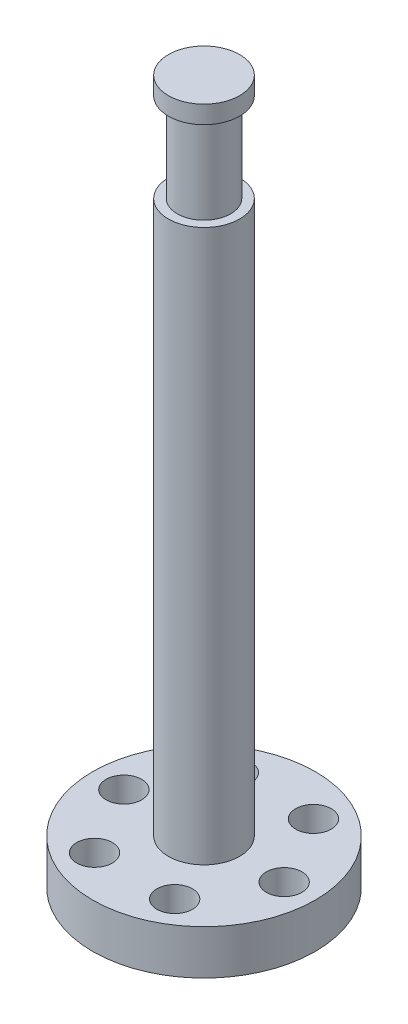
from build123d import *

# Parameters (mm, degrees)
SKETCH_1_R               = 12.5
EXTRUDE_1_DEPTH          = 79
SKETCH_2_OUTSIDE_W       = 44.31
SKETCH_2_OUTSIDE_H       = 44.31
SKETCH_2_OUTSIDE_R       = 4
CUT_EXTRUDE_2_DEPTH      = 72
SKETCH_4_OUTSIDE_W       = 44.31
SKETCH_4_OUTSIDE_H       = 44.31
SKETCH_4_OUTSIDE_R       = 4
CUT_EXTRUDE_3_DEPTH      = 80.003164494
SKETCH_6_OUTSIDE_W       = 44.31
SKETCH_6_OUTSIDE_H       = 44.31
SKETCH_6_OUTSIDE_R       = 3
CUT_EXTRUDE_4_DEPTH      = 10
SKETCH_7_R               = 2
CUT_EXTRUDE_5_DEPTH      = 81.953690466
PATTERN_CIRCULAR_1_COUNT = 6


with BuildPart() as part:
    # 草图1 → 凸台-拉伸1 (new body)
    with BuildSketch(Plane(origin=(0, 0, 0), x_dir=(1, 0, 0), z_dir=(0, 1, 0))):
        Circle(SKETCH_1_R)
    extrude(amount=EXTRUDE_1_DEPTH)

    # 草图2 outside → 切除-拉伸2 (cut)
    with BuildSketch(Plane(origin=(0, 77, 0), x_dir=(1, 0, 0), z_dir=(0, 1, 0))):
        Rectangle(SKETCH_2_OUTSIDE_W, SKETCH_2_OUTSIDE_H)
        Circle(SKETCH_2_OUTSIDE_R, mode=Mode.SUBTRACT)
    extrude(amount=-CUT_EXTRUDE_2_DEPTH, mode=Mode.SUBTRACT)

    # 草图4 outside → 切除-拉伸3 (cut, through all)
    with BuildSketch(Plane(origin=(0, 77, 0), x_dir=(1, 0, 0), z_dir=(0, 1, 0))):
        Rectangle(SKETCH_4_OUTSIDE_W, SKETCH_4_OUTSIDE_H)
        Circle(SKETCH_4_OUTSIDE_R, mode=Mode.SUBTRACT)
    extrude(amount=CUT_EXTRUDE_3_DEPTH, mode=Mode.SUBTRACT)

    # 草图6 outside → 切除-拉伸4 (cut)
    with BuildSketch(Plane(origin=(0, 77, 0), x_dir=(1, 0, 0), z_dir=(0, 1, 0))):
        Rectangle(SKETCH_6_OUTSIDE_W, SKETCH_6_OUTSIDE_H)
        Circle(SKETCH_6_OUTSIDE_R, mode=Mode.SUBTRACT)
    extrude(amount=-CUT_EXTRUDE_4_DEPTH, mode=Mode.SUBTRACT)

    # 草图7 → 切除-拉伸5 (cut, through all)
    with BuildSketch(Plane.XZ):
        with Locations((9, 0)):
            Circle(SKETCH_7_R)
    cut_extrude_5 = extrude(amount=-CUT_EXTRUDE_5_DEPTH, mode=Mode.SUBTRACT)

    # 阵列(圆周)1: 切除-拉伸5 ×6 about axis
    pattern_circular_1_axis = Axis((0, 0, 0), (0, 1, 0))
    for i in range(1, PATTERN_CIRCULAR_1_COUNT):
        add(cut_extrude_5.rotate(pattern_circular_1_axis, i * 360 / PATTERN_CIRCULAR_1_COUNT), mode=Mode.SUBTRACT)


solid = part.part
